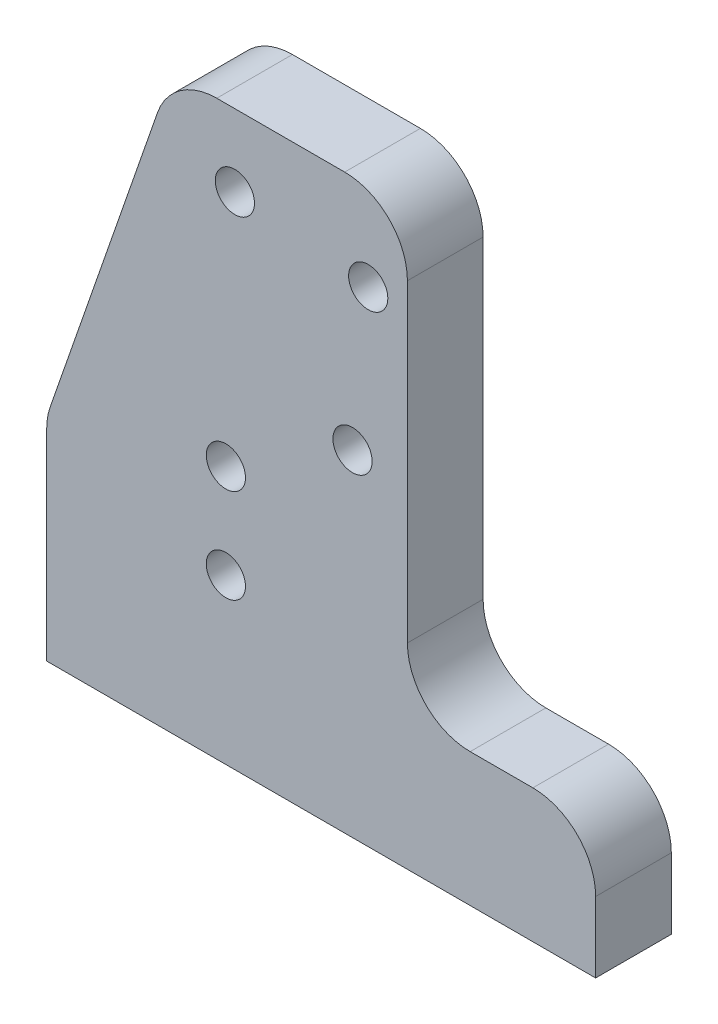
from build123d import *

# Parameters (mm, degrees)
BOSS_EXTRUDE1_DEPTH       = 4.826
M3X0_5_TAPPED_HOLE2_D     = 2.5
M3X0_5_TAPPED_HOLE3_D     = 2.5
M3X0_5_TAPPED_HOLE3_DEPTH = 5
M3X0_5_TAPPED_HOLE3_TIP   = 0.751075774
FILLET2_R                 = 4
M3X0_5_TAPPED_HOLE4_D     = 2.5
M3X0_5_TAPPED_HOLE5_D     = 2.5


with BuildPart() as part:
    # Sketch1 → Boss-Extrude1 (new body)
    with BuildSketch(Plane.XY):
        Polygon((0, 13.5), (0, 0), (35, 0), (35, 8.5), (23, 8.5), (23, 36.5), (8, 36.5), align=None)
    extrude(amount=BOSS_EXTRUDE1_DEPTH)

    # M3x0.5 Tapped Hole2 (through all)
    with Locations(Plane.XY.offset(4.826)):
        with Locations((12, 31.9)):
            Hole(M3X0_5_TAPPED_HOLE2_D / 2)

    # M3x0.5 Tapped Hole3
    with Locations(Plane(origin=(0, 0, 0), x_dir=(-1, 0, 0), z_dir=(0, -1, 0))):
        with Locations((-16.73, -2.413), (-28.73, -2.413)):
            Hole(M3X0_5_TAPPED_HOLE3_D / 2, depth=M3X0_5_TAPPED_HOLE3_DEPTH)
            with Locations((0, 0, -(M3X0_5_TAPPED_HOLE3_DEPTH + M3X0_5_TAPPED_HOLE3_TIP / 2))):  # 118° drill point
                Cone(0, M3X0_5_TAPPED_HOLE3_D / 2, M3X0_5_TAPPED_HOLE3_TIP, mode=Mode.SUBTRACT)

    # Fillet2
    fillet2_edges = [part.edges().sort_by_distance(p)[0] for p in [
        (35, 8.5, 2.413),
        (23, 8.5, 2.413),
        (23, 36.5, 2.413),
        (0, 13.5, 2.413),
        (8, 36.5, 2.413),
    ]]
    fillet(fillet2_edges, radius=FILLET2_R)

    # M3x0.5 Tapped Hole4 (through all)
    with Locations(Plane.XY.offset(4.826)):
        with Locations((19.5, 21.4), (20.5, 30.9)):
            Hole(M3X0_5_TAPPED_HOLE4_D / 2)

    # M3x0.5 Tapped Hole5 (through all)
    with Locations(Plane.XY.offset(4.826)):
        with Locations((11.425, 16.46), (11.425, 10.46)):
            Hole(M3X0_5_TAPPED_HOLE5_D / 2)


solid = part.part
